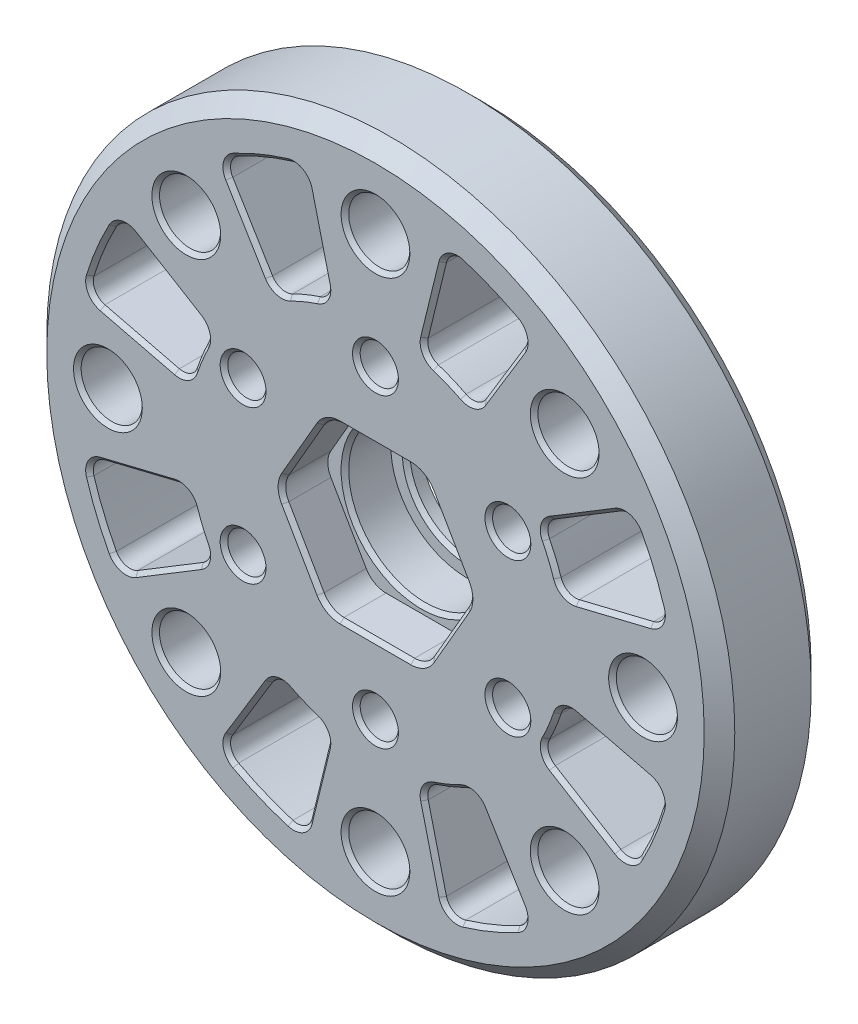
from build123d import *

# Parameters (mm, degrees)
SKETCH_1_R                       = 22.5
SKETCH_1_R_2                     = 2
EXTRUDE_1_DEPTH                  = 7
SKETCH_7_R                       = 5
SKETCH_7_R_2                     = 0.5
CUT_EXTRUDE_3_DEPTH              = 33.580669115
M3X0_5_1_D                       = 2.5
M3X0_5_1_CSINK_D                 = 3
M3X0_5_1_CSINK_ANGLE             = 90
CHAMFER_1_SIZE                   = 1
CUT_EXTRUDE_4_DEPTH              = 33.580669115
FILLET_1_R                       = 1
PATTERN_CIRCULAR_1_COUNT         = 8
FILLET_1_OF_PATTERN_CIRCULAR_1_R = 1
EXTRUDE_START                    = 1
SKETCH_12_R                      = 5
SKETCH_12_R_2                    = 4
EXTRUDE_3_DEPTH                  = 1
CHAMFER_3_SIZE                   = 0.25
CUT_EXTRUDE_6_DEPTH              = 3
FILLET_4_R                       = 1.5
CHAMFER_5_SIZE                   = 0.25
CHAMFER_7_SIZE                   = 0.25
CHAMFER_8_SIZE                   = 0.25


with BuildPart() as part:
    # ｽｹｯﾁ1 → ﾎﾞｽ - 押し出し1 (new body)
    with BuildSketch(Plane.XY):
        Circle(SKETCH_1_R)
        with Locations((0, 17.5)):
            Circle(SKETCH_1_R_2, mode=Mode.SUBTRACT)
        with Locations((12.374368671, 12.374368671)):
            Circle(SKETCH_1_R_2, mode=Mode.SUBTRACT)
        with Locations((17.5, 0)):
            Circle(SKETCH_1_R_2, mode=Mode.SUBTRACT)
        with Locations((12.374368671, -12.374368671)):
            Circle(SKETCH_1_R_2, mode=Mode.SUBTRACT)
        with Locations((0, -17.5)):
            Circle(SKETCH_1_R_2, mode=Mode.SUBTRACT)
        with Locations((-12.374368671, -12.374368671)):
            Circle(SKETCH_1_R_2, mode=Mode.SUBTRACT)
        with Locations((-17.5, 0)):
            Circle(SKETCH_1_R_2, mode=Mode.SUBTRACT)
        with Locations((-12.374368671, 12.374368671)):
            Circle(SKETCH_1_R_2, mode=Mode.SUBTRACT)
    extrude(amount=EXTRUDE_1_DEPTH)

    # ｽｹｯﾁ7 → ｶｯﾄ - 押し出し3 (cut, through all)
    with BuildSketch(Plane.XY.offset(7)):
        Circle(SKETCH_7_R)
        with Locations((0, 10)):
            Circle(SKETCH_7_R_2)
        with Locations((8.660254038, 5)):
            Circle(SKETCH_7_R_2)
        with Locations((8.660254038, -5)):
            Circle(SKETCH_7_R_2)
        with Locations((0, -10)):
            Circle(SKETCH_7_R_2)
        with Locations((-8.660254038, -5)):
            Circle(SKETCH_7_R_2)
        with Locations((-8.660254038, 5)):
            Circle(SKETCH_7_R_2)
    extrude(amount=-CUT_EXTRUDE_3_DEPTH, mode=Mode.SUBTRACT)

    # M3x0.5 ねじ穴1 (through all)
    with Locations(Plane.XY.offset(7)):
        with Locations((0, 10), (8.660254038, 5), (8.660254038, -5), (0, -10), (-8.660254038, -5), (-8.660254038, 5)):
            CounterSinkHole(M3X0_5_1_D / 2, M3X0_5_1_CSINK_D / 2, counter_sink_angle=M3X0_5_1_CSINK_ANGLE)

    # 面取り1
    chamfer_1_edges = [part.edges().sort_by_distance(p)[0] for p in [
        (-22.5, 0, 0),
        (-22.5, 0, 7),
    ]]
    chamfer(chamfer_1_edges, length=CHAMFER_1_SIZE)

    # ｽｹｯﾁ10 → ｶｯﾄ - 押し出し4 (cut, through all)
    with BuildSketch(Plane.XY.offset(7)):
        with BuildLine():
            Line((6.484665727, 10.686398383), (10.116078534, 16.670781478))
            ThreePointArc((10.116078534, 16.670781478), (7.462326931, 18.015650884), (4.6348749, 18.941170361))
            Line((4.6348749, 18.941170361), (2.971073654, 12.141775873))
            ThreePointArc((2.971073654, 12.141775873), (4.783542905, 11.548494156), (6.484665727, 10.686398383))
        make_face()
    cut_extrude_4 = extrude(amount=-CUT_EXTRUDE_4_DEPTH, mode=Mode.SUBTRACT)

    # ﾌｨﾚｯﾄ1
    fillet_1_edges = [part.edges().sort_by_distance(p)[0] for p in [
        (6.484665727, 10.686398383, 3.5),
        (2.971073654, 12.141775873, 3.5),
        (10.116078534, 16.670781478, 3.5),
        (4.6348749, 18.941170361, 3.5),
    ]]
    fillet(fillet_1_edges, radius=FILLET_1_R)

    # 円形ﾊﾟﾀｰﾝ1: ｶｯﾄ - 押し出し4 ×8 about axis
    pattern_circular_1_axis = Axis((0, 0, 0), (0, 0, 1))
    for i in range(1, PATTERN_CIRCULAR_1_COUNT):
        add(cut_extrude_4.rotate(pattern_circular_1_axis, i * 360 / PATTERN_CIRCULAR_1_COUNT), mode=Mode.SUBTRACT)

    # ﾌｨﾚｯﾄ1 of 円形ﾊﾟﾀｰﾝ1
    fillet_1_of_pattern_circular_1_edges = [part.edges().sort_by_distance(p)[0] for p in [
        (-2.971073654, 12.141775873, 3.5),
        (-6.484665727, 10.686398383, 3.5),
        (-4.6348749, 18.941170361, 3.5),
        (-10.116078534, 16.670781478, 3.5),
        (-10.686398383, 6.484665727, 3.5),
        (-12.141775873, 2.971073654, 3.5),
        (-16.670781478, 10.116078534, 3.5),
        (-18.941170361, 4.6348749, 3.5),
        (-12.141775873, -2.971073654, 3.5),
        (-10.686398383, -6.484665727, 3.5),
        (-18.941170361, -4.6348749, 3.5),
        (-16.670781478, -10.116078534, 3.5),
        (-6.484665727, -10.686398383, 3.5),
        (-2.971073654, -12.141775873, 3.5),
        (-10.116078534, -16.670781478, 3.5),
        (-4.6348749, -18.941170361, 3.5),
        (2.971073654, -12.141775873, 3.5),
        (6.484665727, -10.686398383, 3.5),
        (4.6348749, -18.941170361, 3.5),
        (10.116078534, -16.670781478, 3.5),
        (10.686398383, -6.484665727, 3.5),
        (12.141775873, -2.971073654, 3.5),
        (16.670781478, -10.116078534, 3.5),
        (18.941170361, -4.6348749, 3.5),
        (12.141775873, 2.971073654, 3.5),
        (10.686398383, 6.484665727, 3.5),
        (18.941170361, 4.6348749, 3.5),
        (16.670781478, 10.116078534, 3.5),
    ]]
    fillet(fillet_1_of_pattern_circular_1_edges, radius=FILLET_1_OF_PATTERN_CIRCULAR_1_R)

    # ｽｹｯﾁ12 → ﾎﾞｽ - 押し出し3 (add)
    with BuildSketch(Plane.XY.offset(EXTRUDE_START)):
        Circle(SKETCH_12_R)
        Circle(SKETCH_12_R_2, mode=Mode.SUBTRACT)
    extrude(amount=-EXTRUDE_3_DEPTH)

    # 面取り3
    chamfer_3_edges = [part.edges().sort_by_distance(p)[0] for p in [
        (-4, 0, 1),
        (-2, 17.5, 7),
        (10.374368671, 12.374368671, 7),
        (15.5, 0, 7),
        (10.374368671, -12.374368671, 7),
        (-2, -17.5, 7),
        (-14.374368671, -12.374368671, 7),
        (-19.5, 0, 7),
        (-14.374368671, 12.374368671, 7),
    ]]
    chamfer(chamfer_3_edges, length=CHAMFER_3_SIZE)

    # ｽｹｯﾁ14 → ｶｯﾄ - 押し出し6 (cut)
    with BuildSketch(Plane.XY.offset(7)):
        Polygon((3.175426481, 5.5), (-3.175426481, 5.5), (-6.350852961, 0), (-3.175426481, -5.5), (3.175426481, -5.5), (6.350852961, 0), align=None)
    extrude(amount=-CUT_EXTRUDE_6_DEPTH, mode=Mode.SUBTRACT)

    # ﾌｨﾚｯﾄ4
    fillet_4_edges = [part.edges().sort_by_distance(p)[0] for p in [
        (3.175426481, -5.5, 5.5),
        (6.350852961, 0, 5.5),
        (3.175426481, 5.5, 5.5),
        (-6.350852961, 0, 5.5),
        (-3.175426481, -5.5, 5.5),
        (-3.175426481, 5.5, 5.5),
    ]]
    fillet(fillet_4_edges, radius=FILLET_4_R)

    # 面取り5
    chamfer_5_edges = [part.edges().sort_by_distance(p)[0] for p in [
        (-5, 0, 4),
        (6.118802154, 0, 7),
        (4.763139721, -2.75, 7),
        (4.763139721, 2.75, 7),
        (3.059401077, -5.299038106, 7),
        (3.059401077, 5.299038106, 7),
        (0, -5.5, 7),
        (0, 5.5, 7),
        (-3.059401077, -5.299038106, 7),
        (-3.059401077, 5.299038106, 7),
        (-4.763139721, -2.75, 7),
        (-4.763139721, 2.75, 7),
        (-6.118802154, 0, 7),
    ]]
    chamfer(chamfer_5_edges, length=CHAMFER_5_SIZE)

    # 面取り7
    chamfer_7_edges = [part.edges().sort_by_distance(p)[0] for p in [
        (-2, -17.5, 0),
        (-14.374368671, -12.374368671, 0),
        (-19.5, 0, 0),
        (10.374368671, -12.374368671, 0),
        (15.5, 0, 0),
        (10.374368671, 12.374368671, 0),
        (-2, 17.5, 0),
        (-14.374368671, 12.374368671, 0),
        (-7.410254038, -5, 0),
        (1.25, -10, 0),
        (9.910254038, -5, 0),
        (9.910254038, 5, 0),
        (1.25, 10, 0),
        (-7.410254038, 5, 0),
    ]]
    chamfer(chamfer_7_edges, length=CHAMFER_7_SIZE)

    # 面取り8
    chamfer_8_edges = [part.edges().sort_by_distance(p)[0] for p in [
        (-18.015650884, -7.462326931, 7),
        (-16.575381329, -9.69292294, 7),
        (-18.574496078, -4.866632998, 7),
        (-13.651175138, -8.283736426, 7),
        (-15.510324712, -3.795352311, 7),
        (-11.066511081, -6.402809818, 7),
        (-12.35267527, -3.297734789, 7),
        (-11.548494156, -4.783542905, 7),
        (-7.462326931, -18.015650884, 7),
        (-4.866632998, -18.574496078, 7),
        (-9.69292294, -16.575381329, 7),
        (-3.795352311, -15.510324712, 7),
        (-8.283736426, -13.651175138, 7),
        (-3.297734789, -12.35267527, 7),
        (-6.402809818, -11.066511081, 7),
        (-4.783542905, -11.548494156, 7),
        (7.462326931, -18.015650884, 7),
        (9.69292294, -16.575381329, 7),
        (4.866632998, -18.574496078, 7),
        (8.283736426, -13.651175138, 7),
        (3.795352311, -15.510324712, 7),
        (6.402809818, -11.066511081, 7),
        (3.297734789, -12.35267527, 7),
        (4.783542905, -11.548494156, 7),
        (15.510324712, 3.795352311, 7),
        (18.574496078, 4.866632998, 7),
        (12.35267527, 3.297734789, 7),
        (18.015650884, 7.462326931, 7),
        (11.548494156, 4.783542905, 7),
        (16.575381329, 9.69292294, 7),
        (11.066511081, 6.402809818, 7),
        (13.651175138, 8.283736426, 7),
        (4.783542905, 11.548494156, 7),
        (6.402809818, 11.066511081, 7),
        (3.297734789, 12.35267527, 7),
        (8.283736426, 13.651175138, 7),
        (3.795352311, 15.510324712, 7),
        (9.69292294, 16.575381329, 7),
        (4.866632998, 18.574496078, 7),
        (7.462326931, 18.015650884, 7),
        (-4.783542905, 11.548494156, 7),
        (-3.297734789, 12.35267527, 7),
        (-6.402809818, 11.066511081, 7),
        (-3.795352311, 15.510324712, 7),
        (-8.283736426, 13.651175138, 7),
        (-4.866632998, 18.574496078, 7),
        (-9.69292294, 16.575381329, 7),
        (-7.462326931, 18.015650884, 7),
        (-15.510324712, 3.795352311, 7),
        (-12.35267527, 3.297734789, 7),
        (-18.574496078, 4.866632998, 7),
        (-11.548494156, 4.783542905, 7),
        (-18.015650884, 7.462326931, 7),
        (-11.066511081, 6.402809818, 7),
        (-16.575381329, 9.69292294, 7),
        (-13.651175138, 8.283736426, 7),
        (15.510324712, -3.795352311, 7),
        (12.35267527, -3.297734789, 7),
        (18.574496078, -4.866632998, 7),
        (11.548494156, -4.783542905, 7),
        (18.015650884, -7.462326931, 7),
        (11.066511081, -6.402809818, 7),
        (16.575381329, -9.69292294, 7),
        (13.651175138, -8.283736426, 7),
    ]]
    chamfer(chamfer_8_edges, length=CHAMFER_8_SIZE)


solid = part.part
